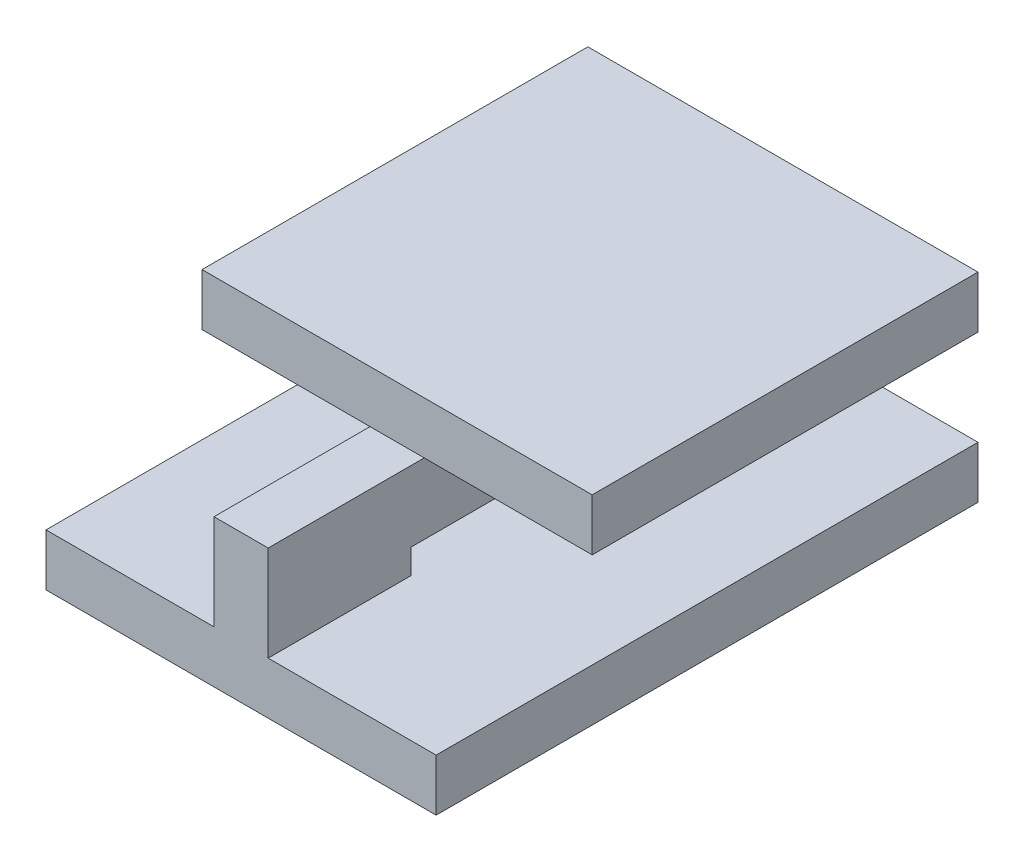
from build123d import *

# Parameters (mm, degrees)
SKETCH1_W           = 90
SKETCH1_H           = 125
BOSS_EXTRUDE1_DEPTH = 12
SKETCH2_W           = 12.5
SKETCH2_H           = 125
BOSS_EXTRUDE2_DEPTH = 22
SKETCH3_W           = 90
SKETCH3_H           = 89
BOSS_EXTRUDE3_DEPTH = 12
SKETCH4_W           = 92.043364018
SKETCH4_H           = 5.697421696
CUT_EXTRUDE1_DEPTH  = 143.714969432
SKETCH5_W           = 12.5
SKETCH5_H           = 3.053408842
CUT_EXTRUDE2_DEPTH  = 60


with BuildPart() as part:
    # Sketch1 → Boss-Extrude1 (new body)
    with BuildSketch(Plane(origin=(0, 0, 0), x_dir=(1, 0, 0), z_dir=(0, 1, 0))):
        with Locations((45, 62.5)):
            Rectangle(SKETCH1_W, SKETCH1_H)
    extrude(amount=BOSS_EXTRUDE1_DEPTH)

    # Sketch2 → Boss-Extrude2 (add)
    with BuildSketch(Plane(origin=(0, 12, 0), x_dir=(1, 0, 0), z_dir=(0, 1, 0))):
        with Locations((45, 62.5)):
            Rectangle(SKETCH2_W, SKETCH2_H)
    extrude(amount=BOSS_EXTRUDE2_DEPTH)

    # Sketch3 → Boss-Extrude3 (add)
    with BuildSketch(Plane(origin=(0, 34, 0), x_dir=(1, 0, 0), z_dir=(0, 1, 0))):
        with Locations((45, 80.5)):
            Rectangle(SKETCH3_W, SKETCH3_H)
    extrude(amount=BOSS_EXTRUDE3_DEPTH)

    # Sketch4 → Cut-Extrude1 (cut, through all)
    with BuildSketch(Plane(origin=(51.25, 0, 0), x_dir=(0, 0, -1), z_dir=(1, 0, 0))):
        with Locations((78.978317991, 14.848710848)):
            Rectangle(SKETCH4_W, SKETCH4_H)
    extrude(amount=-CUT_EXTRUDE1_DEPTH, mode=Mode.SUBTRACT)

    # Sketch5 → Cut-Extrude2 (cut)
    with BuildSketch(Plane(origin=(0, 0, -125), x_dir=(-1, 0, 0), z_dir=(0, 0, -1))):
        with Locations((-45, 32.473295579)):
            Rectangle(SKETCH5_W, SKETCH5_H)
    extrude(amount=-CUT_EXTRUDE2_DEPTH, mode=Mode.SUBTRACT)


solid = part.part
